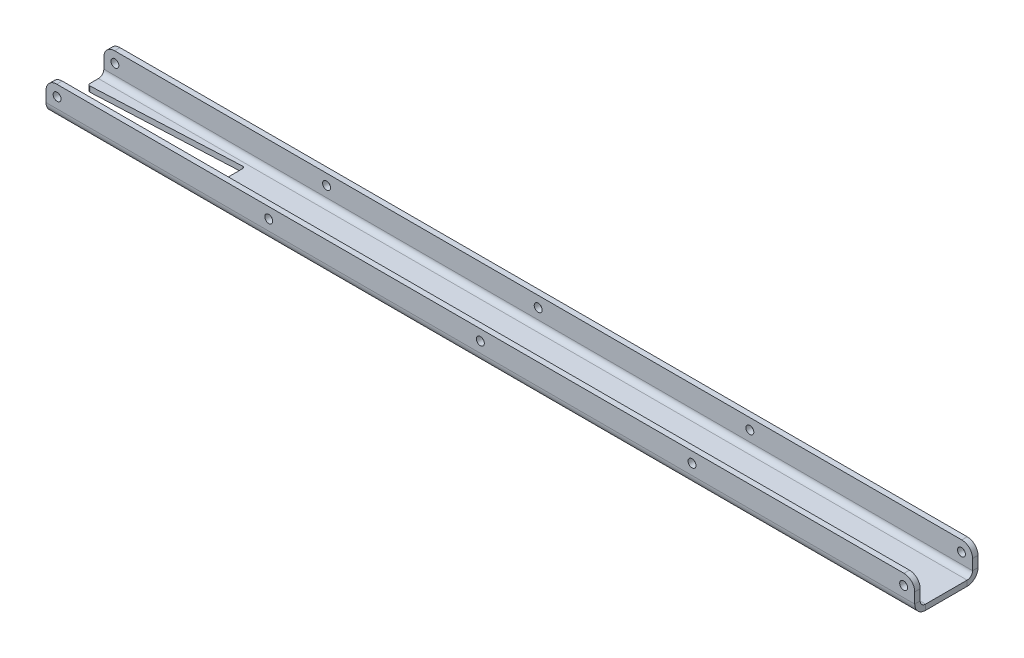
from build123d import *

# Parameters (mm, degrees)
SKETCH1_W                      = 405
SKETCH1_H                      = 29.5
BOSS_EXTRUDE1_DEPTH            = 2.54
EDGE_FLANGE1_STRIP_W           = 15.24
EDGE_FLANGE1_STRIP_H           = 2.54
EDGE_FLANGE1_STRIP_CUT_DEPTH   = 405
EDGE_FLANGE1_STRIP_2_W         = 15.24
EDGE_FLANGE1_STRIP_2_H         = 2.54
EDGE_FLANGE1_STRIP_CUT_2_DEPTH = 405
EDGE_FLANGE1_DEPTH             = 405
EDGE_FLANGE1_BEND_DEPTH        = 405
SKETCH17_R                     = 1.85
CUT_EXTRUDE1_DEPTH             = 206.186500531
CUT_EXTRUDE2_DEPTH             = 204.589814333
FILLET1_R                      = 1
FILLET2_R                      = 5


# Sheet-metal steps are written as plain solids
with BuildPart() as part:
    # Sketch1 → Boss-Extrude1 (new body)
    with BuildSketch(Plane(origin=(0, 0, 0), x_dir=(1, 0, 0), z_dir=(0, 1, 0))):
        Rectangle(SKETCH1_W, SKETCH1_H)
    extrude(amount=BOSS_EXTRUDE1_DEPTH)

    # Edge-Flange1 strip (across the edge) → Edge-Flange1 strip cut (cut)
    with BuildSketch(Plane(origin=(202.5, 2.54, -14.75), x_dir=(0, 0, 1), z_dir=(-1, 0, 0))):
        with Locations((-2.54, -1.27)):
            Rectangle(EDGE_FLANGE1_STRIP_W, EDGE_FLANGE1_STRIP_H)
    extrude(amount=EDGE_FLANGE1_STRIP_CUT_DEPTH, mode=Mode.SUBTRACT)

    # Edge-Flange1 strip 2 (across the edge) → Edge-Flange1 strip cut 2 (cut)
    with BuildSketch(Plane(origin=(-202.5, 2.54, 14.75), x_dir=(0, 0, -1), z_dir=(1, 0, 0))):
        with Locations((-2.54, -1.27)):
            Rectangle(EDGE_FLANGE1_STRIP_2_W, EDGE_FLANGE1_STRIP_2_H)
    extrude(amount=EDGE_FLANGE1_STRIP_CUT_2_DEPTH, mode=Mode.SUBTRACT)

    # Edge-Flange1 section (across the edge) → Edge-Flange1 (add)
    with BuildSketch(Plane(origin=(202.5, 2.54, -14.75), x_dir=(0, 0, 1), z_dir=(-1, 0, 0))):
        with BuildLine():
            Line((0, 2.54), (0, 12.46))
            Line((0, 12.46), (2.54, 12.46))
            Line((2.54, 12.46), (2.54, 2.54))
            ThreePointArc((2.54, 2.54), (3.283948776, 0.743948776), (5.08, 0))
            Line((5.08, 0), (5.08, -2.54))
            ThreePointArc((5.08, -2.54), (1.487897552, -1.052102448), (0, 2.54))
        make_face()
    extrude(amount=EDGE_FLANGE1_DEPTH)

    # Edge-Flange1 section 2 (across the edge) → Edge-Flange1 bend (add)
    with BuildSketch(Plane(origin=(-202.5, 2.54, 14.75), x_dir=(0, 0, -1), z_dir=(1, 0, 0))):
        with BuildLine():
            Line((0, 2.54), (0, 12.46))
            Line((0, 12.46), (2.54, 12.46))
            Line((2.54, 12.46), (2.54, 2.54))
            ThreePointArc((2.54, 2.54), (3.283948776, 0.743948776), (5.08, 0))
            Line((5.08, 0), (5.08, -2.54))
            ThreePointArc((5.08, -2.54), (1.487897552, -1.052102448), (0, 2.54))
        make_face()
    extrude(amount=EDGE_FLANGE1_BEND_DEPTH)

    # Sketch17 → Cut-Extrude1 (cut, through all)
    with BuildSketch(Plane.XY.offset(14.75)):
        with Locations((-197.33398, 10)):
            Circle(SKETCH17_R)
        with Locations((-98.66699, 10)):
            Circle(SKETCH17_R)
        with Locations((0, 10)):
            Circle(SKETCH17_R)
        with Locations((98.66699, 10)):
            Circle(SKETCH17_R)
        with Locations((197.33398, 10)):
            Circle(SKETCH17_R)
    extrude(amount=-CUT_EXTRUDE1_DEPTH, mode=Mode.SUBTRACT)

    # Sketch18 → Cut-Extrude2 (cut, through all)
    with BuildSketch(Plane.XZ):
        Polygon((-202.5, -4.67), (-132.5, -8), (-132.5, 8), (-202.5, 4.67), align=None)
    extrude(amount=-CUT_EXTRUDE2_DEPTH, mode=Mode.SUBTRACT)

    # Fillet1
    fillet1_edges = [part.edges().sort_by_distance(p)[0] for p in [
        (-202.5, 1.27, -4.67),
        (-202.5, 1.27, 4.67),
        (-132.5, 1.27, 8),
        (-132.5, 1.27, -8),
    ]]
    fillet(fillet1_edges, radius=FILLET1_R)

    # Fillet2
    fillet2_edges = [part.edges().sort_by_distance(p)[0] for p in [
        (202.5, 15, -13.48),
        (-202.5, 15, -13.48),
        (-202.5, 15, 13.48),
        (202.5, 15, 13.48),
    ]]
    fillet(fillet2_edges, radius=FILLET2_R)


solid = part.part
